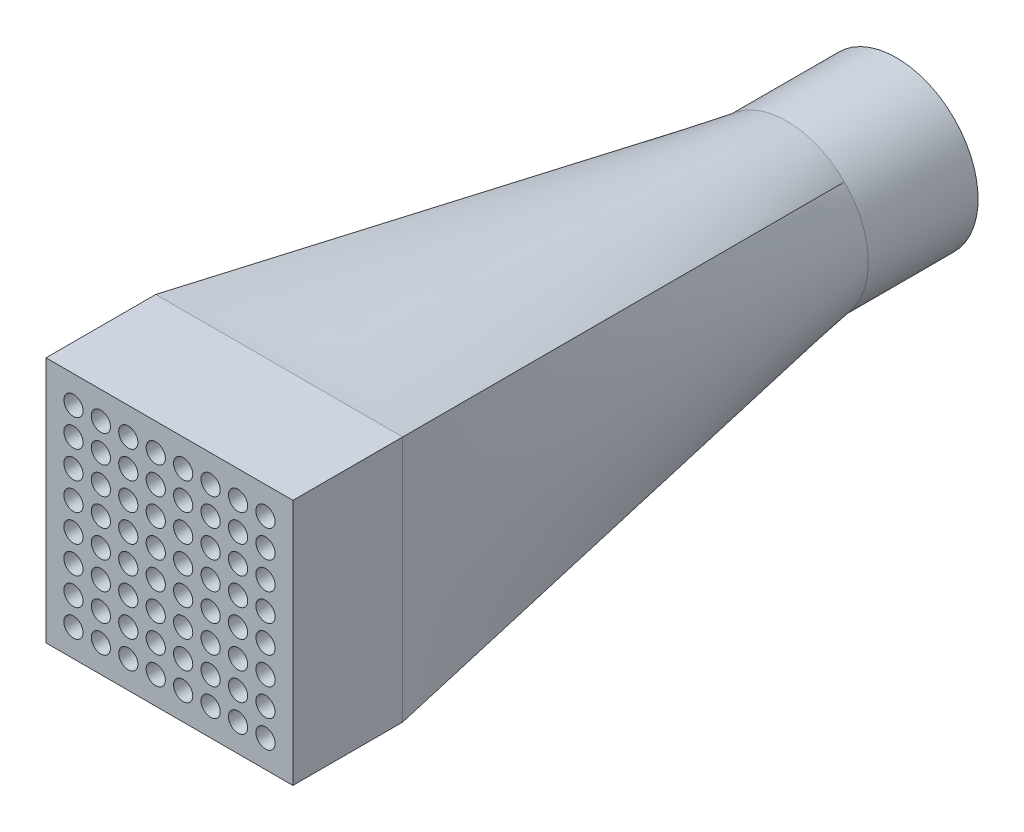
from build123d import *

# Parameters (mm, degrees)
SKETCH4_W           = 18
SKETCH4_H           = 18
BOSS_EXTRUDE1_DEPTH = 8
SKETCH5_R           = 0.7
CUT_EXTRUDE1_DEPTH  = 8
SKETCH6_R           = 5.95
SKETCH6_R_2         = 4.88
BOSS_EXTRUDE2_DEPTH = 8
SKETCH8_R           = 3
CUT_EXTRUDE3_DEPTH  = 7


with BuildPart() as part:
    # Loft1: read off the stored shape, not the designer's step
    # Loft1: loft between two sections, ruled curve by curve
    loft1_from = [
        Edge.make_bspline([(-9, 9, 37), (-8.25, 9, 37), (-7.5, 9, 37), (-6, 9, 37), (-5.25, 9, 37), (-3.75, 9, 37), (-3, 9, 37), (-1.5, 9, 37), (-0.75, 9, 37), (0.75, 9, 37), (1.5, 9, 37), (3, 9, 37), (3.75, 9, 37), (5.25, 9, 37), (6, 9, 37), (7.5, 9, 37), (8.25, 9, 37), (9, 9, 37)], [0, 0, 0, 0, 0.125, 0.125, 0.25, 0.25, 0.375, 0.375, 0.5, 0.5, 0.625, 0.625, 0.75, 0.75, 0.875, 0.875, 1, 1, 1, 1], 3),
        Edge.make_bspline([(9, 9, 37), (9, 8.25, 37), (9, 7.5, 37), (9, 6, 37), (9, 5.25, 37), (9, 3.75, 37), (9, 3, 37), (9, 1.5, 37), (9, 0.75, 37), (9, -0.75, 37), (9, -1.5, 37), (9, -3, 37), (9, -3.75, 37), (9, -5.25, 37), (9, -6, 37), (9, -7.5, 37), (9, -8.25, 37), (9, -9, 37)], [0, 0, 0, 0, 0.125, 0.125, 0.25, 0.25, 0.375, 0.375, 0.5, 0.5, 0.625, 0.625, 0.75, 0.75, 0.875, 0.875, 1, 1, 1, 1], 3),
        Edge.make_bspline([(-9, -9, 37), (-9, -8.25, 37), (-9, -7.5, 37), (-9, -6, 37), (-9, -5.25, 37), (-9, -3.75, 37), (-9, -3, 37), (-9, -1.5, 37), (-9, -0.75, 37), (-9, 0.75, 37), (-9, 1.5, 37), (-9, 3, 37), (-9, 3.75, 37), (-9, 5.25, 37), (-9, 6, 37), (-9, 7.5, 37), (-9, 8.25, 37), (-9, 9, 37)], [0, 0, 0, 0, 0.125, 0.125, 0.25, 0.25, 0.375, 0.375, 0.5, 0.5, 0.625, 0.625, 0.75, 0.75, 0.875, 0.875, 1, 1, 1, 1], 3),
        Edge.make_bspline([(9, -9, 37), (8.25, -9, 37), (7.5, -9, 37), (6, -9, 37), (5.25, -9, 37), (3.75, -9, 37), (3, -9, 37), (1.5, -9, 37), (0.75, -9, 37), (-0.75, -9, 37), (-1.5, -9, 37), (-3, -9, 37), (-3.75, -9, 37), (-5.25, -9, 37), (-6, -9, 37), (-7.5, -9, 37), (-8.25, -9, 37), (-9, -9, 37)], [0, 0, 0, 0, 0.125, 0.125, 0.25, 0.25, 0.375, 0.375, 0.5, 0.5, 0.625, 0.625, 0.75, 0.75, 0.875, 0.875, 1, 1, 1, 1], 3),
    ]
    loft1_to = [
        Edge.make_bspline([(-4.207285348, 4.207285348, 0), (-3.959368681, 4.455202015, 0), (-3.680141586, 4.690350666, 0), (-3.062809983, 5.114882841, 0), (-2.72467395, 5.304128911, 0), (-2.001736485, 5.616999437, 0), (-1.616991653, 5.740470541, 0), (-0.821431093, 5.907022516, 0), (-0.410761783, 5.95, 0), (0.410761783, 5.95, 0), (0.821431093, 5.907022516, 0), (1.616991653, 5.740470541, 0), (2.001736485, 5.616999437, 0), (2.72467395, 5.304128911, 0), (3.062809983, 5.114882841, 0), (3.680141586, 4.690350666, 0), (3.959368681, 4.455202015, 0), (4.207285348, 4.207285348, 0)], [0, 0, 0, 0, 0.125, 0.125, 0.25, 0.25, 0.375, 0.375, 0.5, 0.5, 0.625, 0.625, 0.75, 0.75, 0.875, 0.875, 1, 1, 1, 1], 3),
        Edge.make_bspline([(4.207285348, 4.207285348, 0), (4.455202015, 3.959368681, 0), (4.690350666, 3.680141586, 0), (5.114882841, 3.062809983, 0), (5.304128911, 2.72467395, 0), (5.616999437, 2.001736485, 0), (5.740470541, 1.616991653, 0), (5.907022516, 0.821431093, 0), (5.95, 0.410761783, 0), (5.95, -0.410761783, 0), (5.907022516, -0.821431093, 0), (5.740470541, -1.616991653, 0), (5.616999437, -2.001736485, 0), (5.304128911, -2.72467395, 0), (5.114882841, -3.062809983, 0), (4.690350666, -3.680141586, 0), (4.455202015, -3.959368681, 0), (4.207285348, -4.207285348, 0)], [0, 0, 0, 0, 0.125, 0.125, 0.25, 0.25, 0.375, 0.375, 0.5, 0.5, 0.625, 0.625, 0.75, 0.75, 0.875, 0.875, 1, 1, 1, 1], 3),
        Edge.make_bspline([(-4.207285348, -4.207285348, 0), (-4.455202015, -3.959368681, 0), (-4.690350666, -3.680141586, 0), (-5.114882841, -3.062809983, 0), (-5.304128911, -2.72467395, 0), (-5.616999437, -2.001736485, 0), (-5.740470541, -1.616991653, 0), (-5.907022516, -0.821431093, 0), (-5.95, -0.410761783, 0), (-5.95, 0.410761783, 0), (-5.907022516, 0.821431093, 0), (-5.740470541, 1.616991653, 0), (-5.616999437, 2.001736485, 0), (-5.304128911, 2.72467395, 0), (-5.114882841, 3.062809983, 0), (-4.690350666, 3.680141586, 0), (-4.455202015, 3.959368681, 0), (-4.207285348, 4.207285348, 0)], [0, 0, 0, 0, 0.125, 0.125, 0.25, 0.25, 0.375, 0.375, 0.5, 0.5, 0.625, 0.625, 0.75, 0.75, 0.875, 0.875, 1, 1, 1, 1], 3),
        Edge.make_bspline([(4.207285348, -4.207285348, 0), (3.959368681, -4.455202015, 0), (3.680141586, -4.690350666, 0), (3.062809983, -5.114882841, 0), (2.72467395, -5.304128911, 0), (2.001736485, -5.616999437, 0), (1.616991653, -5.740470541, 0), (0.821431093, -5.907022516, 0), (0.410761783, -5.95, 0), (-0.410761783, -5.95, 0), (-0.821431093, -5.907022516, 0), (-1.616991653, -5.740470541, 0), (-2.001736485, -5.616999437, 0), (-2.72467395, -5.304128911, 0), (-3.062809983, -5.114882841, 0), (-3.680141586, -4.690350666, 0), (-3.959368681, -4.455202015, 0), (-4.207285348, -4.207285348, 0)], [0, 0, 0, 0, 0.125, 0.125, 0.25, 0.25, 0.375, 0.375, 0.5, 0.5, 0.625, 0.625, 0.75, 0.75, 0.875, 0.875, 1, 1, 1, 1], 3),
    ]
    loft1 = Solid(Shell([*[Face.make_surface_from_curves(loft1_from[k], loft1_to[k]) for k in range(4)], Face(Wire(loft1_from)), Face(Wire(loft1_to))]))
    add(loft1)

    # Cut-Loft1: read off the stored shape, not the designer's step
    # Cut-Loft1: loft between two sections, ruled curve by curve
    cut_loft1_from = [
        Edge.make_bspline([(-3.450681092, -3.450681092, 0), (-3.044014426, -3.857347759, 0), (-2.531155679, -4.22197395, 0), (-1.641760344, -4.606883572, 0), (-1.326204919, -4.708150629, 0), (-0.673711552, -4.84475124, 0), (-0.336893697, -4.88, 0), (0.336893697, -4.88, 0), (0.673711552, -4.84475124, 0), (1.326204919, -4.708150629, 0), (1.641760344, -4.606883572, 0), (2.531155679, -4.22197395, 0), (3.044014426, -3.857347759, 0), (3.450681092, -3.450681092, 0)], [0, 0, 0, 0, 0.25, 0.25, 0.375, 0.375, 0.5, 0.5, 0.625, 0.625, 0.75, 0.75, 1, 1, 1, 1], 3),
        Edge.make_bspline([(3.450681092, -3.450681092, 0), (3.857347759, -3.044014426, 0), (4.22197395, -2.531155679, 0), (4.606883572, -1.641760344, 0), (4.708150629, -1.326204919, 0), (4.84475124, -0.673711552, 0), (4.88, -0.336893697, 0), (4.88, 0.336893697, 0), (4.84475124, 0.673711552, 0), (4.708150629, 1.326204919, 0), (4.606883572, 1.641760344, 0), (4.22197395, 2.531155679, 0), (3.857347759, 3.044014426, 0), (3.450681092, 3.450681092, 0)], [0, 0, 0, 0, 0.25, 0.25, 0.375, 0.375, 0.5, 0.5, 0.625, 0.625, 0.75, 0.75, 1, 1, 1, 1], 3),
        Edge.make_bspline([(-3.450681092, 3.450681092, 0), (-3.857347759, 3.044014426, 0), (-4.22197395, 2.531155679, 0), (-4.606883572, 1.641760344, 0), (-4.708150629, 1.326204919, 0), (-4.84475124, 0.673711552, 0), (-4.88, 0.336893697, 0), (-4.88, -0.336893697, 0), (-4.84475124, -0.673711552, 0), (-4.708150629, -1.326204919, 0), (-4.606883572, -1.641760344, 0), (-4.22197395, -2.531155679, 0), (-3.857347759, -3.044014426, 0), (-3.450681092, -3.450681092, 0)], [0, 0, 0, 0, 0.25, 0.25, 0.375, 0.375, 0.5, 0.5, 0.625, 0.625, 0.75, 0.75, 1, 1, 1, 1], 3),
        Edge.make_bspline([(3.450681092, 3.450681092, 0), (3.044014426, 3.857347759, 0), (2.531155679, 4.22197395, 0), (1.641760344, 4.606883572, 0), (1.326204919, 4.708150629, 0), (0.673711552, 4.84475124, 0), (0.336893697, 4.88, 0), (-0.336893697, 4.88, 0), (-0.673711552, 4.84475124, 0), (-1.326204919, 4.708150629, 0), (-1.641760344, 4.606883572, 0), (-2.531155679, 4.22197395, 0), (-3.044014426, 3.857347759, 0), (-3.450681092, 3.450681092, 0)], [0, 0, 0, 0, 0.25, 0.25, 0.375, 0.375, 0.5, 0.5, 0.625, 0.625, 0.75, 0.75, 1, 1, 1, 1], 3),
    ]
    cut_loft1_to = [
        Edge.make_bspline([(-8, -8, 37), (-6.666666667, -8, 37), (-5.333333333, -8, 37), (-3.333333333, -8, 37), (-2.666666667, -8, 37), (-1.333333333, -8, 37), (-0.666666667, -8, 37), (0.666666667, -8, 37), (1.333333333, -8, 37), (2.666666667, -8, 37), (3.333333333, -8, 37), (5.333333333, -8, 37), (6.666666667, -8, 37), (8, -8, 37)], [0, 0, 0, 0, 0.25, 0.25, 0.375, 0.375, 0.5, 0.5, 0.625, 0.625, 0.75, 0.75, 1, 1, 1, 1], 3),
        Edge.make_bspline([(8, -8, 37), (8, -6.666666667, 37), (8, -5.333333333, 37), (8, -3.333333333, 37), (8, -2.666666667, 37), (8, -1.333333333, 37), (8, -0.666666667, 37), (8, 0.666666667, 37), (8, 1.333333333, 37), (8, 2.666666667, 37), (8, 3.333333333, 37), (8, 5.333333333, 37), (8, 6.666666667, 37), (8, 8, 37)], [0, 0, 0, 0, 0.25, 0.25, 0.375, 0.375, 0.5, 0.5, 0.625, 0.625, 0.75, 0.75, 1, 1, 1, 1], 3),
        Edge.make_bspline([(-8, 8, 37), (-8, 6.666666667, 37), (-8, 5.333333333, 37), (-8, 3.333333333, 37), (-8, 2.666666667, 37), (-8, 1.333333333, 37), (-8, 0.666666667, 37), (-8, -0.666666667, 37), (-8, -1.333333333, 37), (-8, -2.666666667, 37), (-8, -3.333333333, 37), (-8, -5.333333333, 37), (-8, -6.666666667, 37), (-8, -8, 37)], [0, 0, 0, 0, 0.25, 0.25, 0.375, 0.375, 0.5, 0.5, 0.625, 0.625, 0.75, 0.75, 1, 1, 1, 1], 3),
        Edge.make_bspline([(8, 8, 37), (6.666666667, 8, 37), (5.333333333, 8, 37), (3.333333333, 8, 37), (2.666666667, 8, 37), (1.333333333, 8, 37), (0.666666667, 8, 37), (-0.666666667, 8, 37), (-1.333333333, 8, 37), (-2.666666667, 8, 37), (-3.333333333, 8, 37), (-5.333333333, 8, 37), (-6.666666667, 8, 37), (-8, 8, 37)], [0, 0, 0, 0, 0.25, 0.25, 0.375, 0.375, 0.5, 0.5, 0.625, 0.625, 0.75, 0.75, 1, 1, 1, 1], 3),
    ]
    cut_loft1 = Solid(Shell([*[Face.make_surface_from_curves(cut_loft1_from[k], cut_loft1_to[k]) for k in range(4)], Face(Wire(cut_loft1_from)), Face(Wire(cut_loft1_to))]))
    add(cut_loft1, mode=Mode.SUBTRACT)

    # Sketch4 → Boss-Extrude1 (add)
    with BuildSketch(Plane.XY.offset(37)):
        Rectangle(SKETCH4_W, SKETCH4_H)
    extrude(amount=BOSS_EXTRUDE1_DEPTH)

    # Sketch5 → Cut-Extrude1 (cut)
    with BuildSketch(Plane.XY.offset(37)):
        with Locations((-7, 7)):
            Circle(SKETCH5_R)
        with Locations((-5, 7)):
            Circle(SKETCH5_R)
        with Locations((-3, 7)):
            Circle(SKETCH5_R)
        with Locations((-1, 7)):
            Circle(SKETCH5_R)
        with Locations((1, 7)):
            Circle(SKETCH5_R)
        with Locations((3, 7)):
            Circle(SKETCH5_R)
        with Locations((5, 7)):
            Circle(SKETCH5_R)
        with Locations((7, 7)):
            Circle(SKETCH5_R)
        with Locations((-5, 5)):
            Circle(SKETCH5_R)
        with Locations((-3, 5)):
            Circle(SKETCH5_R)
        with Locations((-1, 5)):
            Circle(SKETCH5_R)
        with Locations((1, 5)):
            Circle(SKETCH5_R)
        with Locations((3, 5)):
            Circle(SKETCH5_R)
        with Locations((5, 5)):
            Circle(SKETCH5_R)
        with Locations((7, 5)):
            Circle(SKETCH5_R)
        with Locations((-5, 3)):
            Circle(SKETCH5_R)
        with Locations((-3, 3)):
            Circle(SKETCH5_R)
        with Locations((-1, 3)):
            Circle(SKETCH5_R)
        with Locations((1, 3)):
            Circle(SKETCH5_R)
        with Locations((3, 3)):
            Circle(SKETCH5_R)
        with Locations((5, 3)):
            Circle(SKETCH5_R)
        with Locations((7, 3)):
            Circle(SKETCH5_R)
        with Locations((-5, 1)):
            Circle(SKETCH5_R)
        with Locations((-3, 1)):
            Circle(SKETCH5_R)
        with Locations((-1, 1)):
            Circle(SKETCH5_R)
        with Locations((1, 1)):
            Circle(SKETCH5_R)
        with Locations((3, 1)):
            Circle(SKETCH5_R)
        with Locations((5, 1)):
            Circle(SKETCH5_R)
        with Locations((7, 1)):
            Circle(SKETCH5_R)
        with Locations((-5, -1)):
            Circle(SKETCH5_R)
        with Locations((-3, -1)):
            Circle(SKETCH5_R)
        with Locations((-1, -1)):
            Circle(SKETCH5_R)
        with Locations((1, -1)):
            Circle(SKETCH5_R)
        with Locations((3, -1)):
            Circle(SKETCH5_R)
        with Locations((5, -1)):
            Circle(SKETCH5_R)
        with Locations((7, -1)):
            Circle(SKETCH5_R)
        with Locations((-5, -3)):
            Circle(SKETCH5_R)
        with Locations((-3, -3)):
            Circle(SKETCH5_R)
        with Locations((-1, -3)):
            Circle(SKETCH5_R)
        with Locations((1, -3)):
            Circle(SKETCH5_R)
        with Locations((3, -3)):
            Circle(SKETCH5_R)
        with Locations((5, -3)):
            Circle(SKETCH5_R)
        with Locations((7, -3)):
            Circle(SKETCH5_R)
        with Locations((-5, -5)):
            Circle(SKETCH5_R)
        with Locations((-3, -5)):
            Circle(SKETCH5_R)
        with Locations((-1, -5)):
            Circle(SKETCH5_R)
        with Locations((1, -5)):
            Circle(SKETCH5_R)
        with Locations((3, -5)):
            Circle(SKETCH5_R)
        with Locations((5, -5)):
            Circle(SKETCH5_R)
        with Locations((7, -5)):
            Circle(SKETCH5_R)
        with Locations((-5, -7)):
            Circle(SKETCH5_R)
        with Locations((-3, -7)):
            Circle(SKETCH5_R)
        with Locations((-1, -7)):
            Circle(SKETCH5_R)
        with Locations((1, -7)):
            Circle(SKETCH5_R)
        with Locations((3, -7)):
            Circle(SKETCH5_R)
        with Locations((5, -7)):
            Circle(SKETCH5_R)
        with Locations((7, -7)):
            Circle(SKETCH5_R)
        with Locations((-7, 5)):
            Circle(SKETCH5_R)
        with Locations((-7, 3)):
            Circle(SKETCH5_R)
        with Locations((-7, 1)):
            Circle(SKETCH5_R)
        with Locations((-7, -1)):
            Circle(SKETCH5_R)
        with Locations((-7, -3)):
            Circle(SKETCH5_R)
        with Locations((-7, -5)):
            Circle(SKETCH5_R)
        with Locations((-7, -7)):
            Circle(SKETCH5_R)
    extrude(amount=CUT_EXTRUDE1_DEPTH, mode=Mode.SUBTRACT)

    # Sketch6 → Boss-Extrude2 (add)
    with BuildSketch(Plane(origin=(0, 0, 0), x_dir=(-1, 0, 0), z_dir=(0, 0, -1))):
        with Locations(Location((0, 0, 0), (0, 0, 135))):
            Circle(SKETCH6_R)
        with Locations(Location((0, 0, 0), (0, 0, 225))):
            Circle(SKETCH6_R_2, mode=Mode.SUBTRACT)
    extrude(amount=BOSS_EXTRUDE2_DEPTH)

    # Sketch8 → Cut-Extrude3 (cut)
    with BuildSketch(Plane(origin=(0, 0, 0), x_dir=(1, 0, 0), z_dir=(0, 1, 0))):
        with Locations(Location((0, -8.089002327, 0), (0, 0, 270))):
            Circle(SKETCH8_R)
    extrude(amount=-CUT_EXTRUDE3_DEPTH, mode=Mode.SUBTRACT)


solid = part.part
